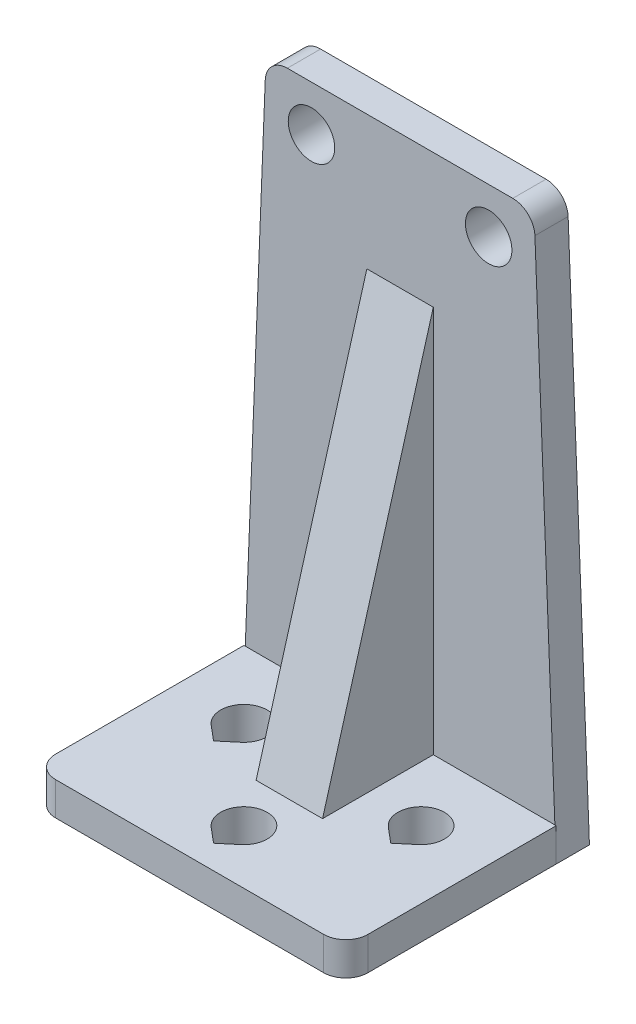
from build123d import *

# Parameters (mm, degrees)
SKETCH1_W           = 28.2
SKETCH1_H           = 19
BOSS_EXTRUDE1_DEPTH = 3
SKETCH2_R           = 2.1
BOSS_EXTRUDE2_DEPTH = 3
BOSS_EXTRUDE3_DEPTH = 3
FILLET1_R           = 2


with BuildPart() as part:
    # Sketch1 → Boss-Extrude1 (new body)
    with BuildSketch(Plane(origin=(0, 0, 0), x_dir=(1, 0, 0), z_dir=(0, 1, 0))):
        with Locations((0, -9.5)):
            Rectangle(SKETCH1_W, SKETCH1_H)
        with BuildLine():
            Line((-9.34985398, -7.708693331), (-8, -8.841355308))
            Line((-8, -8.841355308), (-6.65014602, -7.708693331))
            ThreePointArc((-6.65014602, -7.708693331), (-8, -4), (-9.34985398, -7.708693331))
        make_face(mode=Mode.SUBTRACT)
        with BuildLine():
            Line((-1.34985398, -15.708693331), (0, -16.841355308))
            Line((0, -16.841355308), (1.34985398, -15.708693331))
            ThreePointArc((1.34985398, -15.708693331), (0, -12), (-1.34985398, -15.708693331))
        make_face(mode=Mode.SUBTRACT)
        with BuildLine():
            Line((6.65014602, -7.708693331), (8, -8.841355308))
            Line((8, -8.841355308), (9.34985398, -7.708693331))
            ThreePointArc((9.34985398, -7.708693331), (8, -4), (6.65014602, -7.708693331))
        make_face(mode=Mode.SUBTRACT)
    extrude(amount=BOSS_EXTRUDE1_DEPTH)

    # Sketch2 → Boss-Extrude2 (add)
    with BuildSketch(Plane(origin=(0, 0, 0), x_dir=(-1, 0, 0), z_dir=(0, 0, -1))):
        Polygon((-14.1, 0), (14.1, 0), (12.1, 50.1), (-12.1, 50.1), align=None)
        with Locations((-8, 46)):
            Circle(SKETCH2_R, mode=Mode.SUBTRACT)
        with Locations((8, 46)):
            Circle(SKETCH2_R, mode=Mode.SUBTRACT)
    extrude(amount=BOSS_EXTRUDE2_DEPTH)

    # Sketch3 → Boss-Extrude3 (add, symmetric)
    with BuildSketch(Plane(origin=(0, 0, 0), x_dir=(0, 0, -1), z_dir=(1, 0, 0))):
        Polygon((0, 3), (-10, 3), (0, 38), align=None)
    extrude(amount=BOSS_EXTRUDE3_DEPTH, both=True)

    # Fillet1
    fillet1_edges = [part.edges().sort_by_distance(p)[0] for p in [
        (12.1, 50.1, -1.5),
        (-12.1, 50.1, -1.5),
        (14.1, 1.5, 19),
        (-14.1, 1.5, 19),
    ]]
    fillet(fillet1_edges, radius=FILLET1_R)


solid = part.part
